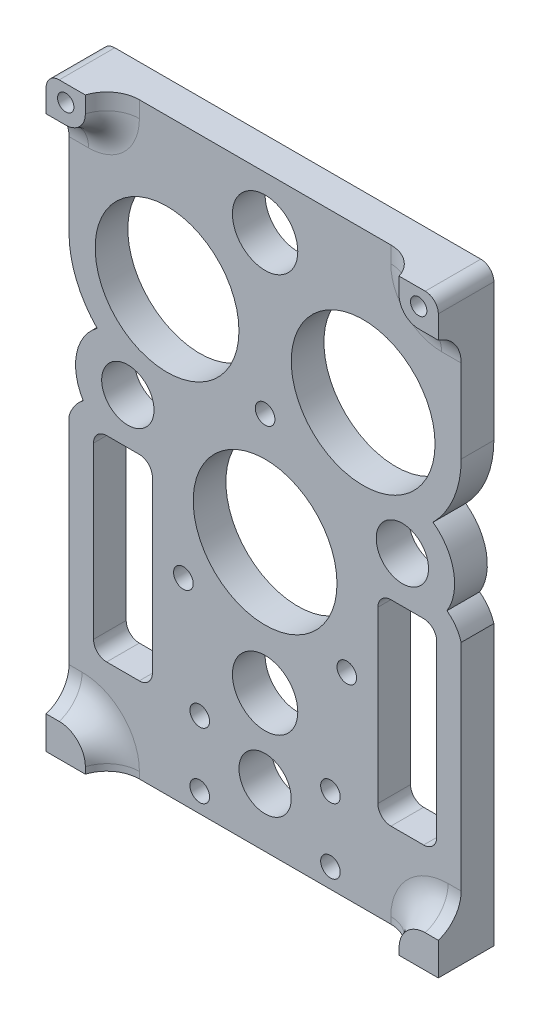
from build123d import *

# Parameters (mm, degrees)
SKETCH1_W            = 60
SKETCH1_H            = 90
BOSS_EXTRUDE1_DEPTH  = 5
SKETCH2_W            = 9
SKETCH2_H            = 30
CUT_EXTRUDE1_DEPTH   = 55.313902456
FILLET1_R            = 2
BOSS_EXTRUDE2_DEPTH  = 3.5
FILLET2_R            = 5
FILLET2_OF_MIRROR1_R = 5
BOSS_EXTRUDE3_DEPTH  = 3.5
SKETCH5_R            = 1.25
CUT_EXTRUDE2_DEPTH   = 55.747146044
FILLET3_R            = 5
FILLET3_OF_MIRROR4_R = 5
FILLET4_R            = 2
SKETCH6_R            = 1.5
CUT_EXTRUDE3_DEPTH   = 55.747146044
SKETCH7_R            = 11
SKETCH7_R_2          = 5
SKETCH7_R_3          = 4
CUT_EXTRUDE4_DEPTH   = 55.313902456


with BuildPart() as part:
    # Sketch1 → Boss-Extrude1 (new body)
    with BuildSketch(Plane.XY):
        Rectangle(SKETCH1_W, SKETCH1_H)
    extrude(amount=BOSS_EXTRUDE1_DEPTH)

    # Sketch2 → Cut-Extrude1 (cut, through all)
    with BuildSketch(Plane(origin=(0, 0, 0), x_dir=(-1, 0, 0), z_dir=(0, 0, -1))):
        with Locations((-21.75, -17)):
            Rectangle(SKETCH2_W, SKETCH2_H)
        with Locations((21.75, -17)):
            Rectangle(SKETCH2_W, SKETCH2_H)
    extrude(amount=-CUT_EXTRUDE1_DEPTH, mode=Mode.SUBTRACT)

    # Fillet1
    fillet1_edges = [part.edges().sort_by_distance(p)[0] for p in [
        (26.25, -32, 2.5),
        (26.25, -2, 2.5),
        (17.25, -2, 2.5),
        (17.25, -32, 2.5),
        (-17.25, -32, 2.5),
        (-17.25, -2, 2.5),
        (-26.25, -2, 2.5),
        (-26.25, -32, 2.5),
    ]]
    fillet(fillet1_edges, radius=FILLET1_R)

    # Sketch3 → Boss-Extrude2 (add)
    with BuildSketch(Plane.XY.offset(5)):
        with BuildLine():
            Line((28, -40), (30, -40))
            Line((30, -40), (30, -45))
            Line((30, -45), (24, -45))
            Line((24, -45), (24, -44))
            ThreePointArc((24, -44), (25.171572875, -41.171572875), (28, -40))
        make_face()
    boss_extrude2 = extrude(amount=BOSS_EXTRUDE2_DEPTH)

    # Fillet2
    # the kernel refuses this fillet: 5 mm, written as the material it adds along each edge
    with BuildSketch(Plane(origin=(28, -40, 5), x_dir=(0, 1, 0), z_dir=(1, 0, 0))) as fillet2_piece_1:
        with BuildLine():
            CenterArc((4.769696007, 5), FILLET2_R, 197.457603124, 72.542396876)
            Line((0, 3.5), (-0.09539392, 3.47))
            ThreePointArc((-0.09539392, 3.47), (-0.1, 1.75), (-0.1, 0))
            Line((-0.1, 0), (0, -0.1))
            Line((0, -0.1), (4.769696007, -0.1))
            Line((4.769696007, -0.1), (4.769696007, 0))
        make_face()
    extrude(amount=2)
    with BuildSketch(Plane(origin=(24, -45, 5), x_dir=(-1, 0, 0), z_dir=(0, 1, 0))) as fillet2_piece_2:
        with BuildLine():
            CenterArc((4.769696007, 5), FILLET2_R, 197.457603124, 72.542396876)
            Line((0, 3.5), (-0.09539392, 3.47))
            ThreePointArc((-0.09539392, 3.47), (-0.1, 1.75), (-0.1, 0))
            Line((-0.1, 0), (0, -0.1))
            Line((0, -0.1), (4.769696007, -0.1))
            Line((4.769696007, -0.1), (4.769696007, 0))
        make_face()
    extrude(amount=1)
    with BuildSketch(Plane(origin=(28, -44, 5), x_dir=(-1, 0, 0), z_dir=(0, -1, 0))) as fillet2_piece_3:
        with BuildLine():
            CenterArc((8.769696007, -5), FILLET2_R, 90, 72.542396876)
            Line((4, -3.5), (3.90460608, -3.47))
            ThreePointArc((3.90460608, -3.47), (3.9, -1.75), (3.9, 0))
            Line((3.9, 0), (4, 0.1))
            Line((4, 0.1), (8.769696007, 0.1))
            Line((8.769696007, 0.1), (8.769696007, 0))
        make_face()
    revolve(axis=Axis((28, -44, 5), (0, 0, -1)), revolution_arc=90)

    # Mirror1: Boss-Extrude2 across plane
    add(boss_extrude2.mirror(Plane(origin=(0, 0, 0), x_dir=(0, 0, 1), z_dir=(1, 0, 0))))

    # Fillet2 of Mirror1
    # the kernel refuses this fillet: 5 mm, written as the material it adds along each edge
    with BuildSketch(Plane(origin=(-28, -40, 5), x_dir=(0, 0, 1), z_dir=(-1, 0, 0))) as fillet2_of_mirror1_piece_1:
        with BuildLine():
            CenterArc((5, 4.769696007), FILLET2_OF_MIRROR1_R, 180, 72.542396876)
            Line((0, 4.769696007), (-0.1, 4.769696007))
            Line((-0.1, 4.769696007), (-0.1, 0))
            Line((-0.1, 0), (0, -0.1))
            ThreePointArc((0, -0.1), (1.75, -0.1), (3.47, -0.09539392))
            Line((3.47, -0.09539392), (3.5, 0))
        make_face()
    extrude(amount=2)
    with BuildSketch(Plane(origin=(-24, -45, 5), x_dir=(0, 0, 1), z_dir=(0, 1, 0))) as fillet2_of_mirror1_piece_2:
        with BuildLine():
            CenterArc((5, 4.769696007), FILLET2_OF_MIRROR1_R, 180, 72.542396876)
            Line((0, 4.769696007), (-0.1, 4.769696007))
            Line((-0.1, 4.769696007), (-0.1, 0))
            Line((-0.1, 0), (0, -0.1))
            ThreePointArc((0, -0.1), (1.75, -0.1), (3.47, -0.09539392))
            Line((3.47, -0.09539392), (3.5, 0))
        make_face()
    extrude(amount=1)
    with BuildSketch(Plane(origin=(-28, -44, 5), x_dir=(1, 0, 0), z_dir=(0, -1, 0))) as fillet2_of_mirror1_piece_3:
        with BuildLine():
            CenterArc((8.769696007, 5), FILLET2_OF_MIRROR1_R, 197.457603124, 72.542396876)
            Line((8.769696007, 0), (8.769696007, -0.1))
            Line((8.769696007, -0.1), (4, -0.1))
            Line((4, -0.1), (3.9, 0))
            ThreePointArc((3.9, 0), (3.9, 1.75), (3.90460608, 3.47))
            Line((3.90460608, 3.47), (4, 3.5))
        make_face()
    revolve(axis=Axis((-28, -44, 5), (0, 0, 1)), revolution_arc=90)

    # Sketch4 → Boss-Extrude3 (add)
    with BuildSketch(Plane.XY.offset(5)):
        with BuildLine():
            Line((24, 45), (24, 42.5))
            ThreePointArc((24, 42.5), (24.878679656, 40.378679656), (27, 39.5))
            Line((27, 39.5), (30, 39.5))
            Line((30, 39.5), (30, 45))
            Line((30, 45), (24, 45))
        make_face()
    boss_extrude3 = extrude(amount=BOSS_EXTRUDE3_DEPTH)

    # Sketch5 → Cut-Extrude2 (cut, through all)
    with BuildSketch(Plane.XY.offset(8.5)):
        with Locations((27, 42.5)):
            Circle(SKETCH5_R)
    cut_extrude2 = extrude(amount=-CUT_EXTRUDE2_DEPTH, mode=Mode.SUBTRACT)

    # Fillet3
    # the kernel refuses this fillet: 5 mm, written as the material it adds along each edge
    with BuildSketch(Plane(origin=(24, 45, 5), x_dir=(-1, 0, 0), z_dir=(0, -1, 0))) as fillet3_piece_1:
        with BuildLine():
            CenterArc((4.769696007, -5), FILLET3_R, 90, 72.542396876)
            Line((0, -3.5), (-0.09539392, -3.47))
            ThreePointArc((-0.09539392, -3.47), (-0.1, -1.75), (-0.1, 0))
            Line((-0.1, 0), (0, 0.1))
            Line((0, 0.1), (4.769696007, 0.1))
            Line((4.769696007, 0.1), (4.769696007, 0))
        make_face()
    extrude(amount=2.5)
    with BuildSketch(Plane(origin=(27, 42.5, 5), x_dir=(-1, 0, 0), z_dir=(0, 1, 0))) as fillet3_piece_2:
        with BuildLine():
            CenterArc((7.769696007, 5), FILLET3_R, 197.457603124, 72.542396876)
            Line((3, 3.5), (2.90460608, 3.47))
            ThreePointArc((2.90460608, 3.47), (2.9, 1.75), (2.9, 0))
            Line((2.9, 0), (3, -0.1))
            Line((3, -0.1), (7.769696007, -0.1))
            Line((7.769696007, -0.1), (7.769696007, 0))
        make_face()
    revolve(axis=Axis((27, 42.5, 5), (0, 0, 1)), revolution_arc=90)
    with BuildSketch(Plane(origin=(27, 39.5, 5), x_dir=(0, -1, 0), z_dir=(1, 0, 0))) as fillet3_piece_3:
        with BuildLine():
            CenterArc((4.769696007, -5), FILLET3_R, 90, 72.542396876)
            Line((0, -3.5), (-0.09539392, -3.47))
            ThreePointArc((-0.09539392, -3.47), (-0.1, -1.75), (-0.1, 0))
            Line((-0.1, 0), (0, 0.1))
            Line((0, 0.1), (4.769696007, 0.1))
            Line((4.769696007, 0.1), (4.769696007, 0))
        make_face()
    extrude(amount=3)

    # Mirror4: Boss-Extrude3, Cut-Extrude2 across plane
    add(boss_extrude3.mirror(Plane(origin=(0, 0, 0), x_dir=(0, 0, 1), z_dir=(1, 0, 0))))
    add(cut_extrude2.mirror(Plane(origin=(0, 0, 0), x_dir=(0, 0, 1), z_dir=(1, 0, 0))), mode=Mode.SUBTRACT)

    # Fillet3 of Mirror4
    # the kernel refuses this fillet: 5 mm, written as the material it adds along each edge
    with BuildSketch(Plane(origin=(-24, 45, 5), x_dir=(1, 0, 0), z_dir=(0, -1, 0))) as fillet3_of_mirror4_piece_1:
        with BuildLine():
            CenterArc((4.769696007, 5), FILLET3_OF_MIRROR4_R, 197.457603124, 72.542396876)
            Line((0, 3.5), (-0.09539392, 3.47))
            ThreePointArc((-0.09539392, 3.47), (-0.1, 1.75), (-0.1, 0))
            Line((-0.1, 0), (0, -0.1))
            Line((0, -0.1), (4.769696007, -0.1))
            Line((4.769696007, -0.1), (4.769696007, 0))
        make_face()
    extrude(amount=2.5)
    with BuildSketch(Plane(origin=(-27, 42.5, 5), x_dir=(1, 0, 0), z_dir=(0, 1, 0))) as fillet3_of_mirror4_piece_2:
        with BuildLine():
            CenterArc((7.769696007, -5), FILLET3_OF_MIRROR4_R, 90, 72.542396876)
            Line((3, -3.5), (2.90460608, -3.47))
            ThreePointArc((2.90460608, -3.47), (2.9, -1.75), (2.9, 0))
            Line((2.9, 0), (3, 0.1))
            Line((3, 0.1), (7.769696007, 0.1))
            Line((7.769696007, 0.1), (7.769696007, 0))
        make_face()
    revolve(axis=Axis((-27, 42.5, 5), (0, 0, -1)), revolution_arc=90)
    with BuildSketch(Plane(origin=(-27, 39.5, 5), x_dir=(0, -1, 0), z_dir=(-1, 0, 0))) as fillet3_of_mirror4_piece_3:
        with BuildLine():
            CenterArc((4.769696007, 5), FILLET3_OF_MIRROR4_R, 197.457603124, 72.542396876)
            Line((0, 3.5), (-0.09539392, 3.47))
            ThreePointArc((-0.09539392, 3.47), (-0.1, 1.75), (-0.1, 0))
            Line((-0.1, 0), (0, -0.1))
            Line((0, -0.1), (4.769696007, -0.1))
            Line((4.769696007, -0.1), (4.769696007, 0))
        make_face()
    extrude(amount=3)

    # Fillet4
    fillet4_edges = [part.edges().sort_by_distance(p)[0] for p in [
        (-30, 45, 4.25),
        (30, 45, 4.25),
    ]]
    fillet(fillet4_edges, radius=FILLET4_R)

    # Sketch6 → Cut-Extrude3 (cut, through all)
    with BuildSketch(Plane(origin=(0, 0, 0), x_dir=(-1, 0, 0), z_dir=(0, 0, -1))):
        with Locations((-10, -32)):
            Circle(SKETCH6_R)
        with Locations((-10, -42)):
            Circle(SKETCH6_R)
        with Locations((10, -42)):
            Circle(SKETCH6_R)
        with Locations((10, -32)):
            Circle(SKETCH6_R)
        with Locations((0, 13)):
            Circle(SKETCH6_R)
        with Locations((12.5, -15)):
            Circle(SKETCH6_R)
        with Locations((-12.5, -15)):
            Circle(SKETCH6_R)
    extrude(amount=-CUT_EXTRUDE3_DEPTH, mode=Mode.SUBTRACT)

    # Sketch7 → Cut-Extrude4 (cut, through all)
    with BuildSketch(Plane.XY.offset(5)):
        with Locations((-15, 22)):
            Circle(SKETCH7_R)
        with Locations((15, 22)):
            Circle(SKETCH7_R)
        with Locations((0, -4)):
            Circle(SKETCH7_R)
        with Locations((0, -24)):
            Circle(SKETCH7_R_2)
        with Locations((0, -36)):
            Circle(SKETCH7_R_3)
        with Locations((0, 37)):
            Circle(SKETCH7_R_2)
        with Locations((-21, 5)):
            Circle(SKETCH7_R_3)
        with Locations((21, 5)):
            Circle(SKETCH7_R_3)
        with BuildLine():
            Line((30, 22), (30, 5))
            Line((30, 5), (30, -2.28608635))
            ThreePointArc((30, -2.28608635), (29.162980054, -0.555783544), (27.82175868, 0.821051746))
            ThreePointArc((27.82175868, 0.821051746), (28.844928487, 6.567513007), (25.692059794, 11.479550516))
            ThreePointArc((25.692059794, 11.479550516), (28.881298515, 16.315850852), (30, 22))
        make_face()
        with BuildLine():
            Line((-30, 5), (-30, -2.28608635))
            ThreePointArc((-30, -2.28608635), (-29.162980054, -0.555783544), (-27.82175868, 0.821051746))
            ThreePointArc((-27.82175868, 0.821051746), (-28.844928487, 6.567513007), (-25.692059794, 11.479550516))
            ThreePointArc((-25.692059794, 11.479550516), (-28.881298515, 16.315850852), (-30, 22))
            Line((-30, 22), (-30, 5))
        make_face()
    extrude(amount=-CUT_EXTRUDE4_DEPTH, mode=Mode.SUBTRACT)


solid = part.part
